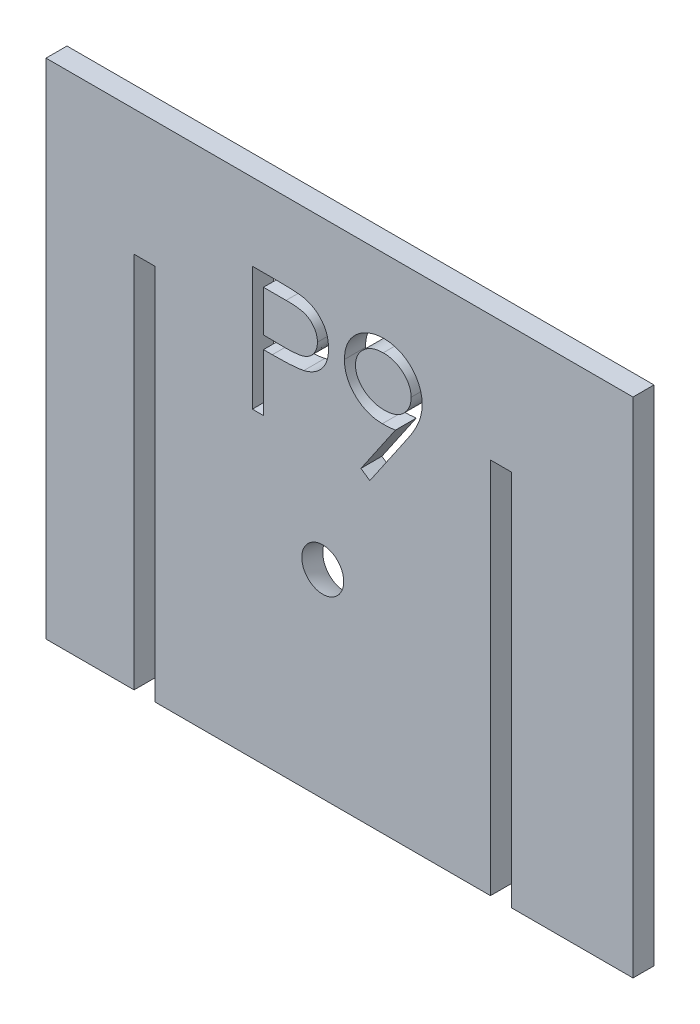
from build123d import *

# Parameters (mm, degrees)
BOSS_EXTRUDE1_DEPTH = 6.35
CUT_EXTRUDE1_DEPTH  = 1287.13369896
CAVITY1_OUTLINE_R   = 12.7


# Read off the part's stored shape, not the designer's step: Cavity1
with BuildPart() as part:
    # Sketch1 → Boss-Extrude1 (new, symmetric)
    with BuildSketch(Plane.XY):
        Polygon((798.4, 381), (1001.6, 381), (1001.6, 609.6), (1014.3, 609.6), (1014.3, 381), (1087.96, 381), (1087.96, 685.8), (732.36, 685.8), (732.36, 381), (785.7, 381), (785.7, 609.6), (798.4, 609.6), align=None)
    extrude(amount=BOSS_EXTRUDE1_DEPTH, both=True)

    # Sketch2 → Cut-Extrude1 (cut, through all)
    # profile 1 of 2: a face of its own
    with BuildSketch(Plane.XY.offset(6.35)):
        with BuildLine():
            Line((857.36, 639.129868283), (872.068533654, 639.129868283))
            add(Edge.make_bspline(
                [(872.068533654, 639.129868283), (873.080195928, 639.128756221), (875.018585774, 639.12662546), (877.798194111, 639.062023764), (880.32268836, 638.975737505), (882.586625094, 638.856125508), (884.596970053, 638.714770002), (886.344626472, 638.516512016), (887.843331251, 638.309505682), (888.741326596, 638.099046971), (889.150865385, 638.003065399)],
                knots=[0, 0, 0, 0, 1.415646017, 2.712440637, 3.8905458, 4.950247383, 5.884950622, 6.709939814, 7.411656543, 8, 8, 8, 8], degree=3))
            add(Edge.make_bspline(
                [(889.150865385, 638.003065399), (889.669298251, 637.861166474), (890.693947763, 637.580712294), (892.170398687, 637.018989648), (893.575123947, 636.352943252), (894.912943057, 635.593858826), (896.167416265, 634.709168165), (897.35726, 633.734733499), (898.471973864, 632.64805703), (899.505289404, 631.46132689), (900.454249352, 630.19446525), (901.271313982, 628.828560324), (901.955468847, 627.386603822), (902.542253236, 625.869598725), (902.96457726, 624.264806079), (903.282725111, 622.583376528), (903.484659989, 620.82549031), (903.504000598, 619.624207434), (903.513846154, 619.012680783)],
                knots=[0, 0, 0, 0, 0.999701418, 1.975846123, 2.934577507, 3.890451536, 4.834027766, 5.787354733, 6.749476667, 7.726910423, 8.712836071, 9.690891519, 10.682875813, 11.679750201, 12.712814741, 13.765529915, 14.8625177, 16, 16, 16, 16], degree=3))
            add(Edge.make_bspline(
                [(903.513846154, 619.012680783), (903.504815624, 618.396014138), (903.487146782, 617.189464196), (903.275083525, 615.424333021), (902.989436562, 613.737510375), (902.550214012, 612.132736436), (901.974949589, 610.619541355), (901.300119885, 609.174800669), (900.486187091, 607.823093414), (899.55094074, 606.559512323), (898.510549432, 605.382871345), (897.369415043, 604.301697178), (896.132144489, 603.322318497), (894.802669888, 602.442539704), (893.36803027, 601.682762286), (891.849984122, 601.002248609), (890.235336627, 600.430725881), (889.117997042, 600.130081708), (888.549903846, 599.977224052)],
                knots=[0, 0, 0, 0, 1.121902311, 2.195077645, 3.232258892, 4.234102512, 5.217864754, 6.176164875, 7.132989551, 8.084763148, 9.034132444, 9.988522005, 10.94243251, 11.903244335, 12.886203696, 13.894208494, 14.929344452, 16, 16, 16, 16], degree=3))
            add(Edge.make_bspline(
                [(888.549903846, 599.977224052), (888.080032403, 599.877303029), (887.050281817, 599.658320298), (885.354366342, 599.413853365), (883.379822358, 599.205190493), (881.129344931, 599.048737545), (878.604954111, 598.914801078), (875.805284311, 598.808341923), (872.7248398, 598.749845055), (870.576170284, 598.746828067), (869.454350962, 598.745252899)],
                knots=[0, 0, 0, 0, 0.601384939, 1.31797006, 2.144135048, 3.087295005, 4.142315834, 5.309527816, 6.595305764, 8, 8, 8, 8], degree=3))
            Line((869.454350962, 598.745252899), (864.090769231, 598.745252899))
            Line((864.090769231, 598.745252899), (864.090769231, 564.129868283))
            Line((864.090769231, 564.129868283), (857.36, 564.129868283))
            Line((857.36, 564.129868283), (857.36, 639.129868283))
        make_face()
        with BuildLine():
            Line((864.090769231, 631.437560591), (864.090769231, 606.437560591))
            Line((864.090769231, 606.437560591), (877.221778846, 606.272296168))
            add(Edge.make_bspline(
                [(877.221778846, 606.272296168), (877.862920114, 606.271964805), (879.100630112, 606.271325116), (880.888549181, 606.356722762), (882.547319624, 606.455305605), (884.071846239, 606.599646822), (885.462816263, 606.803673768), (886.722549025, 607.009639581), (887.841276516, 607.307611636), (889.150545125, 607.708820261), (890.609473999, 608.393090596), (892.196635753, 609.386302526), (893.541719747, 610.652317702), (894.705683249, 612.07577123), (895.629380633, 613.659324004), (896.305580468, 615.353658362), (896.702890983, 617.141397995), (896.756166562, 618.364715256), (896.783076923, 618.982632706)],
                knots=[0, 0, 0, 0, 1.160613943, 2.240541288, 3.23993089, 4.169200891, 5.011653406, 5.7853311, 6.478053781, 7.106038997, 8.262395093, 9.384106736, 10.481365981, 11.59014053, 12.70357646, 13.786202915, 14.881775077, 16, 16, 16, 16], degree=3))
            add(Edge.make_bspline(
                [(896.783076923, 618.982632706), (896.756020212, 619.585600852), (896.70223482, 620.784226898), (896.302466324, 622.540914625), (895.630695313, 624.217394005), (894.699482573, 625.781102977), (893.569315503, 627.19943449), (892.25575815, 628.431515784), (890.76190255, 629.421980843), (889.3722976, 630.06126545), (888.13798647, 630.45159278), (887.065873044, 630.724696505), (885.855358591, 630.94274521), (884.50604903, 631.119305984), (883.02840259, 631.270451582), (881.409724413, 631.373008237), (879.656146344, 631.433039442), (878.438776968, 631.436017054), (877.807716346, 631.437560591)],
                knots=[0, 0, 0, 0, 1.120700087, 2.227813068, 3.331159281, 4.466773991, 5.599788987, 6.693661531, 7.80175334, 8.91857717, 9.525282508, 10.207424825, 10.974604443, 11.810962634, 12.737642355, 13.736264703, 14.826523623, 16, 16, 16, 16], degree=3))
            Line((877.807716346, 631.437560591), (864.090769231, 631.437560591))
        make_face(mode=Mode.SUBTRACT)
    # profile 2 of 2: a face of its own
    with BuildSketch(Plane.XY.offset(6.35)):
        with BuildLine():
            Line((928.513846154, 562.20679136), (923.135240385, 565.947776937))
            Line((923.135240385, 565.947776937), (943.988605769, 596.431550976))
            add(Edge.make_bspline(
                [(943.988605769, 596.431550976), (942.658090006, 596.268842476), (940.038230289, 595.948460368), (937.399578102, 595.889603481), (936.100985577, 595.860637514)],
                knots=[0, 0, 0, 0, 1.015715272, 2, 2, 2, 2], degree=3))
            add(Edge.make_bspline(
                [(936.100985577, 595.860637514), (935.313655981, 595.880803438), (933.768196835, 595.920387384), (931.496089994, 596.234140419), (929.312827982, 596.717357443), (927.224198927, 597.438402194), (925.222352394, 598.334506673), (923.311658536, 599.445728394), (921.494689454, 600.75300607), (919.79095924, 602.249427317), (918.241421978, 603.892528442), (916.860922741, 605.631577933), (915.71361277, 607.486777305), (914.760543084, 609.420282009), (914.03774765, 611.459882385), (913.511407558, 613.58236953), (913.187357108, 615.802619002), (913.148805061, 617.313871804), (913.129230769, 618.081190399)],
                knots=[0, 0, 0, 0, 1.060718605, 2.082097864, 3.085795603, 4.069760067, 5.054557537, 6.03741023, 7.043284206, 8.066802108, 9.088538119, 10.083643548, 11.053783639, 12.022749082, 12.983451788, 13.964007469, 14.966251758, 16, 16, 16, 16], degree=3))
            add(Edge.make_bspline(
                [(913.129230769, 618.081190399), (913.166397229, 619.130518671), (913.23934745, 621.190137205), (913.826458534, 624.199432255), (914.792037231, 627.044858189), (916.13835959, 629.718933774), (917.834103621, 632.183192471), (919.872144839, 634.403376952), (922.24008693, 636.347909535), (924.88398734, 638.019425479), (927.741552071, 639.363746849), (930.734451887, 640.354589003), (933.83975446, 640.937419314), (935.943347392, 641.014259195), (937.002427885, 641.052945206)],
                knots=[0, 0, 0, 0, 1.022988612, 2.007919123, 2.978103895, 3.94594894, 4.918897164, 5.887013414, 6.875921846, 7.89917871, 8.930658928, 9.948724884, 10.967259574, 12, 12, 12, 12], degree=3))
            add(Edge.make_bspline(
                [(937.002427885, 641.052945206), (938.041465447, 641.013727426), (940.094505736, 640.93623679), (943.113555877, 640.368723167), (946.005149097, 639.412223035), (948.753255955, 638.090410955), (951.297671931, 636.433534362), (953.585725029, 634.459223139), (955.565200866, 632.166247555), (957.232855454, 629.610065626), (958.571499174, 626.863630314), (959.537333809, 623.996831975), (960.131883216, 621.030287947), (960.206804511, 619.02040636), (960.244615385, 618.006070206)],
                knots=[0, 0, 0, 0, 1.026385292, 2.028040595, 3.023318987, 4.028184125, 5.03290303, 6.015178782, 7.004435299, 8.016004309, 9.023023918, 10.015172535, 10.998308025, 12, 12, 12, 12], degree=3))
            add(Edge.make_bspline(
                [(960.244615385, 618.006070206), (960.219363765, 617.218703767), (960.168147171, 615.621727896), (959.809512018, 613.195363407), (959.20050805, 610.721408489), (958.50940022, 608.627374295), (957.842282341, 606.897907514), (957.214400948, 605.531802229), (956.517711943, 604.093918015), (955.705166969, 602.599332202), (954.831689182, 601.028992167), (953.844704685, 599.398648258), (952.766728146, 597.70611269), (951.998948438, 596.565103661), (951.605793269, 595.980829822)],
                knots=[0, 0, 0, 0, 1.179839688, 2.393009684, 3.667231171, 4.993948276, 5.694988576, 6.444077775, 7.246288328, 8.089075292, 8.993003841, 9.939041771, 10.944649915, 12, 12, 12, 12], degree=3))
            Line((951.605793269, 595.980829822), (928.513846154, 562.20679136))
        make_face()
        with BuildLine():
            add(Edge.make_bspline(
                [(937.347980769, 603.552945206), (937.944423929, 603.569239144), (939.105495994, 603.600957902), (940.806438116, 603.794013086), (942.411956761, 604.136312788), (943.926340675, 604.627449474), (945.364774287, 605.22009238), (946.704409892, 605.974634938), (947.946368647, 606.874991401), (949.098967083, 607.886634594), (950.122481364, 609.01057567), (951.034117735, 610.186942241), (951.808987037, 611.420898169), (952.421057261, 612.727896647), (952.924298163, 614.076122543), (953.271826993, 615.487287297), (953.46434842, 616.95403874), (953.497167882, 617.950438555), (953.513846154, 618.45679136)],
                knots=[0, 0, 0, 0, 1.163407946, 2.26475976, 3.333800367, 4.359385343, 5.366239384, 6.363380779, 7.350133999, 8.353570782, 9.349036268, 10.310270964, 11.253520213, 12.184142, 13.120487599, 14.056272588, 15.012232024, 16, 16, 16, 16], degree=3))
            add(Edge.make_bspline(
                [(953.513846154, 618.45679136), (953.4994961, 618.963355615), (953.471217559, 619.961602615), (953.244346851, 621.430525612), (952.845234927, 622.838238344), (952.309724541, 624.192447557), (951.604290872, 625.482026954), (950.757787607, 626.723167064), (949.752092254, 627.907998373), (948.594894408, 629.008655165), (947.347011129, 630.023253005), (946.017143267, 630.918668918), (944.616252209, 631.669123127), (943.15288457, 632.288386767), (941.623991379, 632.771639103), (940.030477345, 633.11915406), (938.364290084, 633.311405943), (937.233262524, 633.344017968), (936.656875, 633.360637514)],
                knots=[0, 0, 0, 0, 0.972161553, 1.915763587, 2.844109794, 3.775983486, 4.705125789, 5.659731448, 6.655561913, 7.682237399, 8.721216875, 9.739758359, 10.754845918, 11.767244016, 12.7857855, 13.828538656, 14.893392813, 16, 16, 16, 16], degree=3))
            add(Edge.make_bspline(
                [(936.656875, 633.360637514), (936.085500285, 633.343991121), (934.9644678, 633.311331034), (933.313092955, 633.119519495), (931.730353644, 632.769301976), (930.205890353, 632.288610609), (928.742566195, 631.669076931), (927.34174121, 630.918629596), (926.01156228, 630.02345912), (924.764875406, 629.007856853), (923.605634219, 627.913121579), (922.617230026, 626.717976674), (921.768789482, 625.482672578), (921.064325135, 624.192275973), (920.528556908, 622.838284139), (920.129514016, 621.430513208), (919.902624761, 619.961605847), (919.874348763, 618.963356703), (919.86, 618.45679136)],
                knots=[0, 0, 0, 0, 1.099389452, 2.15699305, 3.192601482, 4.213358962, 5.227959689, 6.245255729, 7.266013209, 8.307253147, 9.336162325, 10.327954924, 11.284637477, 12.215801273, 13.149702402, 14.080068371, 15.025723358, 16, 16, 16, 16], degree=3))
            add(Edge.make_bspline(
                [(919.86, 618.45679136), (919.872984131, 617.950044244), (919.898591214, 616.950646184), (920.145615279, 615.482223479), (920.558721276, 614.074619322), (921.111993931, 612.714147029), (921.840599434, 611.414035783), (922.73468189, 610.180449456), (923.782657877, 608.999404096), (924.970518327, 607.889249556), (926.270550347, 606.870274366), (927.65905205, 605.980337608), (929.112119983, 605.228785228), (930.634869214, 604.625755572), (932.216014926, 604.141219927), (933.869767741, 603.794643955), (935.590658544, 603.602809668), (936.756586726, 603.569726161), (937.347980769, 603.552945206)],
                knots=[0, 0, 0, 0, 0.952633368, 1.87876736, 2.791047057, 3.707742249, 4.635551637, 5.587206343, 6.568248508, 7.601284464, 8.641511608, 9.671105535, 10.699146789, 11.713763218, 12.747829548, 13.806491675, 14.887386225, 16, 16, 16, 16], degree=3))
        make_face(mode=Mode.SUBTRACT)
    extrude(amount=-CUT_EXTRUDE1_DEPTH, mode=Mode.SUBTRACT)


with BuildPart() as cut_extrude1_piece_1:
    # of the separate pieces the step leaves, piece 1, a body of its own (cut_extrude1_pieces)
    add(part.part.solids().sort_by_distance((798.4, 381, -6.35))[0])

    # Cavity1 outline → Cavity1 (revolve, cut)
    with BuildSketch(Plane(origin=(0, 420.499546279, 23.05), x_dir=(0, 1, 0), z_dir=(0, 0, -1))):
        with Locations((82.55, 900)):
            Circle(CAVITY1_OUTLINE_R)
    revolve(axis=Axis((0, 420.499546279, 23.05), (1, 0, 0)), mode=Mode.SUBTRACT)


with BuildPart() as cut_extrude1_piece_2:
    # of the separate pieces the step leaves, piece 2, a body of its own (cut_extrude1_pieces)
    add(part.part.solids().sort_by_distance((953.513846154, 618.45679136, -6.35))[0])


with BuildPart() as cut_extrude1_piece_3:
    # of the separate pieces the step leaves, piece 3, a body of its own (cut_extrude1_pieces)
    add(part.part.solids().sort_by_distance((877.807716346, 631.437560591, -6.35))[0])


solid = Compound([cut_extrude1_piece_1.part, cut_extrude1_piece_2.part, cut_extrude1_piece_3.part])
